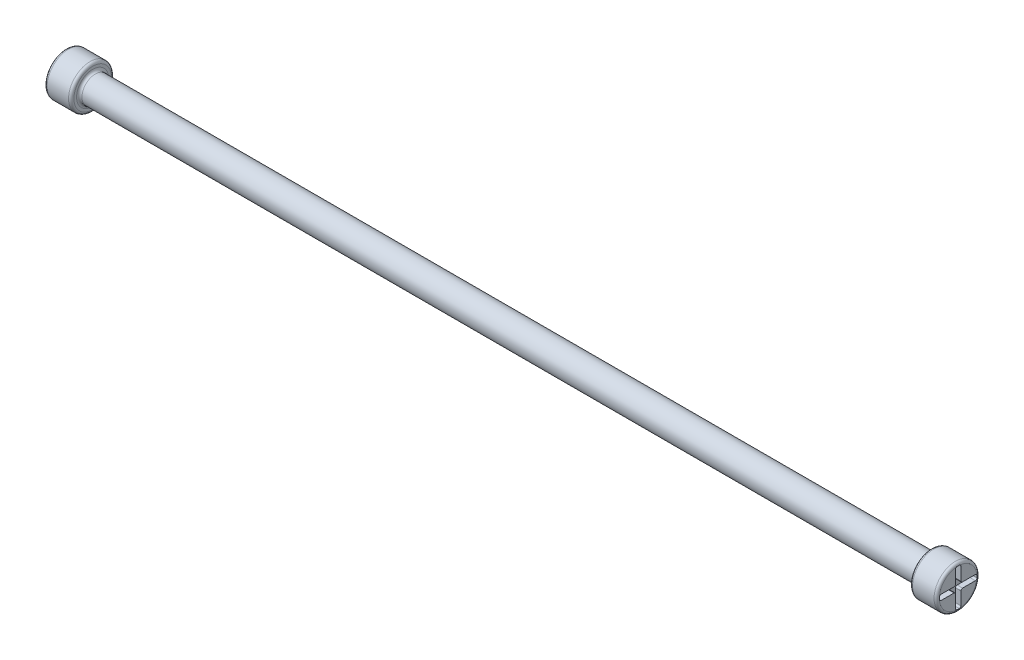
from build123d import *

# Parameters (mm, degrees)
BOSS_EXTRUDE1_DEPTH      = 167.005
BOSS_EXTRUDE1_DEPTH_BACK = 167.005
SKETCH1_R                = 6.35
SKETCH2_R                = 6.35
BOSS_EXTRUDE2_DEPTH      = 31.75
SKETCH3_R                = 10.16
BOSS_EXTRUDE3_DEPTH      = 12.7
FILLET3_R                = 1.27
CUT_EXTRUDE1_DEPTH       = 2.54


# Read off the part's stored shape, not the designer's step: Mirror1
with BuildPart() as part:
    # Sketch1 → Boss-Extrude1 (new, two sides: drawn at the far end of the back side and taken through both)
    with BuildSketch(Plane(origin=(0, 0, 0), x_dir=(0, 0, -1), z_dir=(1, 0, 0)).offset(-BOSS_EXTRUDE1_DEPTH_BACK)):
        Circle(SKETCH1_R)
    extrude(amount=BOSS_EXTRUDE1_DEPTH + BOSS_EXTRUDE1_DEPTH_BACK)

    # Sketch2 → Boss-Extrude2 (add)
    with BuildSketch(Plane.ZY.offset(167.005)):
        with Locations(Location((0, 0, 0), (0, 0, 180))):
            Circle(SKETCH2_R)
    extrude(amount=BOSS_EXTRUDE2_DEPTH)

    # Sketch3 → Boss-Extrude3 (add)
    with BuildSketch(Plane.ZY.offset(198.755)):
        Circle(SKETCH3_R)
    extrude(amount=BOSS_EXTRUDE3_DEPTH)

    # Fillet3
    fillet3_edges = [part.edges().sort_by_distance(p)[0] for p in [
        (-198.755, 0, -10.16),
        (-211.455, 0, -10.16),
        (-198.755, 0, 6.35),
    ]]
    fillet(fillet3_edges, radius=FILLET3_R)

    # Sketch4 → Cut-Extrude1 (cut)
    with BuildSketch(Plane.ZY.offset(211.455)):
        with BuildLine():
            Line((-0.539710702, 8.905623261), (0.476289298, 8.905623261))
            ThreePointArc((0.476289298, 8.905623261), (1.015104666, 8.682438628), (1.238289298, 8.143623261))
            Line((1.238289298, 8.143623261), (1.238289298, 2.047623261))
            ThreePointArc((1.238289298, 2.047623261), (1.461473931, 1.508807894), (2.000289298, 1.285623261))
            Line((2.000289298, 1.285623261), (8.096289298, 1.285623261))
            ThreePointArc((8.096289298, 1.285623261), (8.635104666, 1.062438628), (8.858289298, 0.523623261))
            Line((8.858289298, 0.523623261), (8.858289298, -0.492376739))
            ThreePointArc((8.858289298, -0.492376739), (8.635104666, -1.031192106), (8.096289298, -1.254376739))
            Line((8.096289298, -1.254376739), (2.000289298, -1.254376739))
            ThreePointArc((2.000289298, -1.254376739), (1.461473931, -1.477561372), (1.238289298, -2.016376739))
            Line((1.238289298, -2.016376739), (1.238289298, -8.112376739))
            ThreePointArc((1.238289298, -8.112376739), (1.015104666, -8.651192106), (0.476289298, -8.874376739))
            Line((0.476289298, -8.874376739), (-0.539710702, -8.874376739))
            ThreePointArc((-0.539710702, -8.874376739), (-1.078526069, -8.651192106), (-1.301710702, -8.112376739))
            Line((-1.301710702, -8.112376739), (-1.301710702, -2.016376739))
            ThreePointArc((-1.301710702, -2.016376739), (-1.524895334, -1.477561372), (-2.063710702, -1.254376739))
            Line((-2.063710702, -1.254376739), (-8.159710702, -1.254376739))
            ThreePointArc((-8.159710702, -1.254376739), (-8.698526069, -1.031192106), (-8.921710702, -0.492376739))
            Line((-8.921710702, -0.492376739), (-8.921710702, 0.523623261))
            ThreePointArc((-8.921710702, 0.523623261), (-8.698526069, 1.062438628), (-8.159710702, 1.285623261))
            Line((-8.159710702, 1.285623261), (-2.063710702, 1.285623261))
            ThreePointArc((-2.063710702, 1.285623261), (-1.524895334, 1.508807894), (-1.301710702, 2.047623261))
            Line((-1.301710702, 2.047623261), (-1.301710702, 8.143623261))
            ThreePointArc((-1.301710702, 8.143623261), (-1.078526069, 8.682438628), (-0.539710702, 8.905623261))
        make_face()
    extrude(amount=-CUT_EXTRUDE1_DEPTH, mode=Mode.SUBTRACT)

    # Mirror1: part across plane


with BuildPart() as part_1:
    add(part.part)
    add(part.part.mirror(Plane(origin=(0, 0, 0), x_dir=(0, 0, 1), z_dir=(1, 0, 0))))


solid = part_1.part
